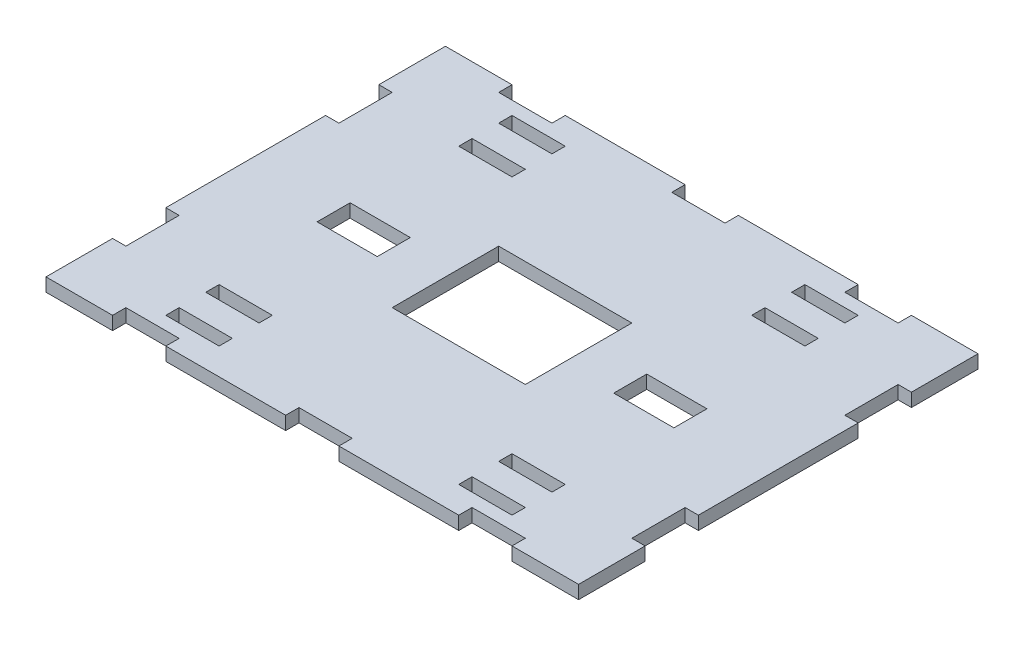
from build123d import *

# Parameters (mm, degrees)
SKETCH1_W           = 20
SKETCH1_H           = 5
SKETCH1_W_2         = 50
SKETCH1_H_2         = 40
SKETCH1_W_3         = 22.6
SKETCH1_H_3         = 12.4
BOSS_EXTRUDE1_DEPTH = 5


with BuildPart() as part:
    # Sketch1 → Boss-Extrude1 (new body)
    with BuildSketch(Plane(origin=(0, 0, 0), x_dir=(1, 0, 0), z_dir=(0, 1, 0))):
        Polygon((-100, 75), (-75, 75), (-75, 70), (-55, 70), (-55, 75), (-10, 75), (-10, 70), (10, 70), (10, 75), (55, 75), (55, 70), (75, 70), (75, 75), (100, 75), (100, 50), (95, 50), (95, 30), (100, 30), (100, -30), (95, -30), (95, -50), (100, -50), (100, -75), (75, -75), (75, -70), (55, -70), (55, -75), (10, -75), (10, -70), (-10, -70), (-10, -75), (-55, -75), (-55, -70), (-75, -70), (-75, -75), (-100, -75), (-100, -50), (-95, -50), (-95, -30), (-100, -30), (-100, 30), (-95, 30), (-95, 50), (-100, 50), align=None)
        with Locations((-55, -47.5)):
            Rectangle(SKETCH1_W, SKETCH1_H, mode=Mode.SUBTRACT)
        with Locations((-55, -62.5)):
            Rectangle(SKETCH1_W, SKETCH1_H, mode=Mode.SUBTRACT)
        Rectangle(SKETCH1_W_2, SKETCH1_H_2, mode=Mode.SUBTRACT)
        with Locations((55, -62.5)):
            Rectangle(SKETCH1_W, SKETCH1_H, mode=Mode.SUBTRACT)
        with Locations((55, -47.5)):
            Rectangle(SKETCH1_W, SKETCH1_H, mode=Mode.SUBTRACT)
        with Locations((55, 47.5)):
            Rectangle(SKETCH1_W, SKETCH1_H, mode=Mode.SUBTRACT)
        with Locations((55, 62.5)):
            Rectangle(SKETCH1_W, SKETCH1_H, mode=Mode.SUBTRACT)
        with Locations((-55, 62.5)):
            Rectangle(SKETCH1_W, SKETCH1_H, mode=Mode.SUBTRACT)
        with Locations((-55, 47.5)):
            Rectangle(SKETCH1_W, SKETCH1_H, mode=Mode.SUBTRACT)
        with Locations((55.7, 0)):
            Rectangle(SKETCH1_W_3, SKETCH1_H_3, mode=Mode.SUBTRACT)
        with Locations((-55.7, 0)):
            Rectangle(SKETCH1_W_3, SKETCH1_H_3, mode=Mode.SUBTRACT)
    extrude(amount=BOSS_EXTRUDE1_DEPTH)


solid = part.part
